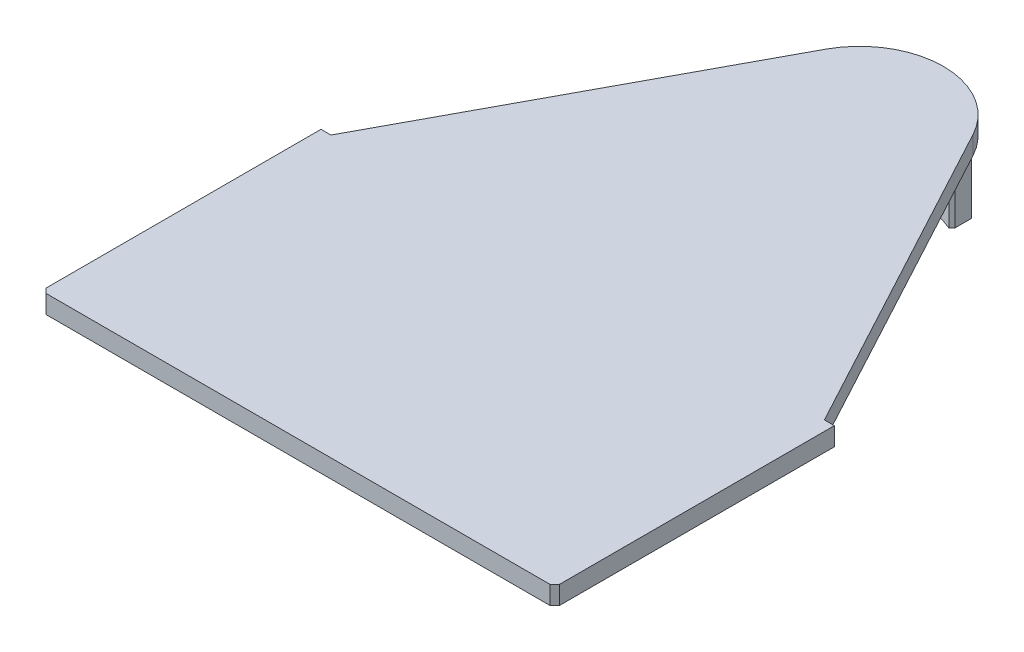
from build123d import *

# Parameters (mm, degrees)
BOSS_EXTRUDE1_DEPTH = 2
SKETCH1_21_R        = 3.5
BOSS_EXTRUDE4_DEPTH = 9
FILLET2_R           = 0.5
BOSS_EXTRUDE5_DEPTH = 9.9
CHAMFER1_START      = -11
CHAMFER1_DEPTH      = 11
SKETCH7_W           = 1.5
SKETCH7_H           = 32
CUT_EXTRUDE2_DEPTH  = 10
SKETCH8_W           = 56
SKETCH8_H           = 1.5
CUT_EXTRUDE3_DEPTH  = 10
CHAMFER3_SIZE       = 0.5


with BuildPart() as part:
    # Sketch1 → Boss-Extrude1 (new body)
    with BuildSketch(Plane(origin=(0, 0, 0), x_dir=(1, 0, 0), z_dir=(0, 1, 0))):
        with BuildLine():
            Line((26.916456077, -7.14), (8.050130866, 27.948393818))
            ThreePointArc((8.050130866, 27.948393818), (0, 32.76), (-8.050130866, 27.948393818))
            Line((-8.050130866, 27.948393818), (-26.916456077, -7.14))
            Line((-26.916456077, -7.14), (-29.5, -7.14))
            Line((-29.5, -7.14), (-29.5, -39.14))
            Line((-29.5, -39.14), (29.5, -39.14))
            Line((29.5, -39.14), (29.5, -7.14))
            Line((29.5, -7.14), (26.916456077, -7.14))
        make_face()
    extrude(amount=BOSS_EXTRUDE1_DEPTH)

    # Sketch1<21> → Boss-Extrude4 (add)
    with BuildSketch(Plane(origin=(0, 0, 0), x_dir=(1, 0, 0), z_dir=(0, 1, 0))):
        with Locations(Location((0, 11.81, 0), (0, 0, 270))):
            Circle(SKETCH1_21_R)
    extrude(amount=-BOSS_EXTRUDE4_DEPTH)

    # Fillet2
    fillet2_edges = [part.edges().sort_by_distance(p)[0] for p in [
        (0, -9, -15.31),
    ]]
    fillet(fillet2_edges, radius=FILLET2_R)


with BuildPart() as boss_extrude5_tool:
    # Sketch5 → Boss-Extrude5 (new body)
    with BuildSketch(Plane.XZ):
        with BuildLine():
            Line((-4, -31.838247988), (-4, -29.538247988))
            add(Edge.make_bspline(
                [(-4, -29.538247988), (0, -31.381752012), (4, -29.538247988)],
                knots=[0, 0, 0, 1, 1, 1], degree=2))
            Line((4, -29.538247988), (4, -31.838247988))
            add(Edge.make_bspline(
                [(-4, -31.838247988), (0, -33.681752012), (4, -31.838247988)],
                knots=[0, 0, 0, 1, 1, 1], degree=2))
        make_face()
    extrude(amount=BOSS_EXTRUDE5_DEPTH)


with BuildPart() as part_1:
    add(part.part)


with BuildPart() as part_2:
    # Boss-Extrude5: joined with boss_extrude5_tool
    add(part_1.part.fuse(boss_extrude5_tool.part, tol=0.00001))

    # Chamfer1: read off the stored shape, not the designer's step
    # Chamfer1 outline → Chamfer1 (cut)
    with BuildSketch(Plane(origin=(0, 0, 0), x_dir=(1, 0, 0), z_dir=(0, 1, 0)).offset(CHAMFER1_START)):
        with BuildLine():
            add(Edge.make_bspline(
                [(-4, 29.538247988), (-3.765305918, 29.64641286), (-3.530611836, 29.741884903)],
                knots=[0, 0, 0, 0.05867352, 0.05867352, 0.05867352], degree=2))
            Line((-3.530611836, 29.741884903), (-4, 29.915108654))
            Line((-4, 29.915108654), (-4, 29.538247988))
        make_face()
        with BuildLine():
            Line((4, 30.038247988), (3.652991042, 29.69123903))
            add(Edge.make_bspline(
                [(3.652991042, 29.69123903), (3.826495521, 29.61821204), (4, 29.538247988)],
                knots=[0.95662388, 0.95662388, 0.95662388, 1, 1, 1], degree=2))
            Line((4, 29.538247988), (4, 30.038247988))
        make_face()
    extrude(amount=CHAMFER1_DEPTH, mode=Mode.SUBTRACT)

    # Sketch7 → Cut-Extrude2 (cut)
    with BuildSketch(Plane.XZ):
        with Locations((28.75, 23.14)):
            Rectangle(SKETCH7_W, SKETCH7_H)
        with Locations((-28.75, 23.14)):
            Rectangle(SKETCH7_W, SKETCH7_H)
    extrude(amount=-CUT_EXTRUDE2_DEPTH, mode=Mode.SUBTRACT)

    # Sketch8 → Cut-Extrude3 (cut)
    with BuildSketch(Plane.XZ):
        with Locations((0, 38.39)):
            Rectangle(SKETCH8_W, SKETCH8_H)
    extrude(amount=-CUT_EXTRUDE3_DEPTH, mode=Mode.SUBTRACT)

    # Chamfer3
    chamfer3_edges = [part_2.edges().sort_by_distance(p)[0] for p in [
        (-28, 1, 37.64),
        (28, 1, 37.64),
    ]]
    chamfer(chamfer3_edges, length=CHAMFER3_SIZE)


solid = part_2.part
